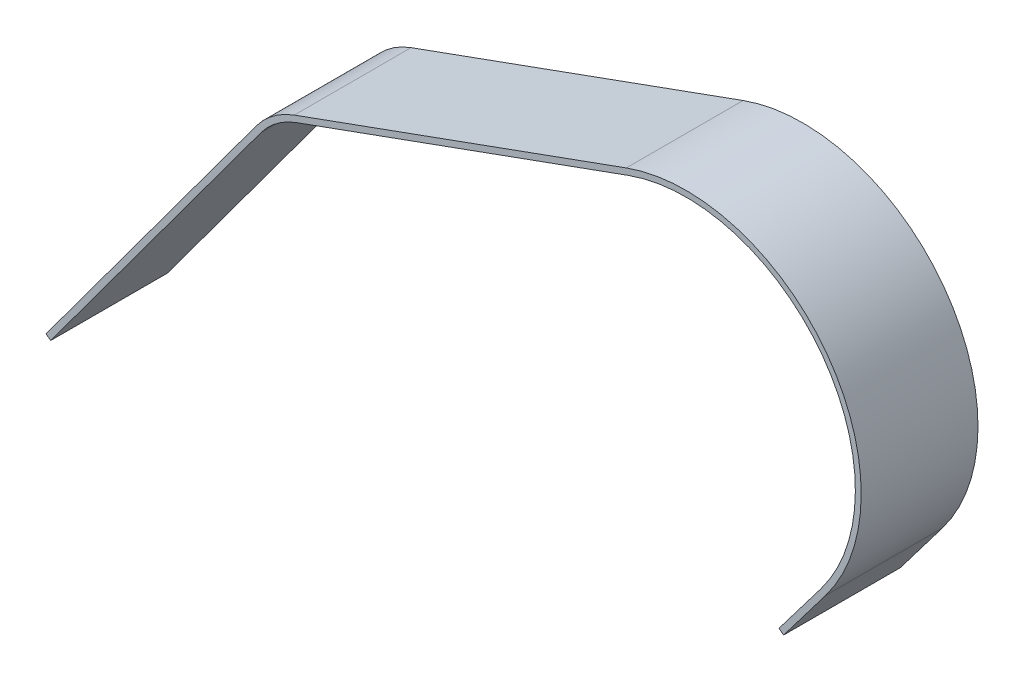
from build123d import *

# Parameters (mm, degrees)
EXTRUDE_THIN1_DEPTH = 63.5


with BuildPart() as part:
    # Sketch1 → Extrude-Thin1 (new body)
    with BuildSketch(Plane.XY):
        with BuildLine():
            Line((-171.530725158, -169.540176263), (-57.207776809, -14.493356815))
            ThreePointArc((-57.207776809, -14.493356815), (-48.029088686, -5.258412911), (-36.568222458, 0.920668726))
            Line((-36.568222458, 0.920668726), (143.952557391, 66.301099815))
            ThreePointArc((143.952557391, 66.301099815), (253.095507904, 33.210999285), (252.264699452, -80.834816757))
            Line((252.264699452, -80.834816757), (229.469051384, -110.874685447))
            Line((229.469051384, -110.874685447), (226.93983158, -108.955395947))
            Line((226.93983158, -108.955395947), (249.735479648, -78.915527258))
            ThreePointArc((249.735479648, -78.915527258), (250.538594484, 31.328761583), (145.033742323, 63.315858762))
            Line((145.033742323, 63.315858762), (-35.487037526, -2.064572327))
            ThreePointArc((-35.487037526, -2.064572327), (-46.129270453, -7.80229099), (-54.652337995, -16.377596044))
            Line((-54.652337995, -16.377596044), (-168.975286345, -171.424415492))
            Line((-168.975286345, -171.424415492), (-171.530725158, -169.540176263))
        make_face()
    extrude(amount=EXTRUDE_THIN1_DEPTH)


solid = part.part
